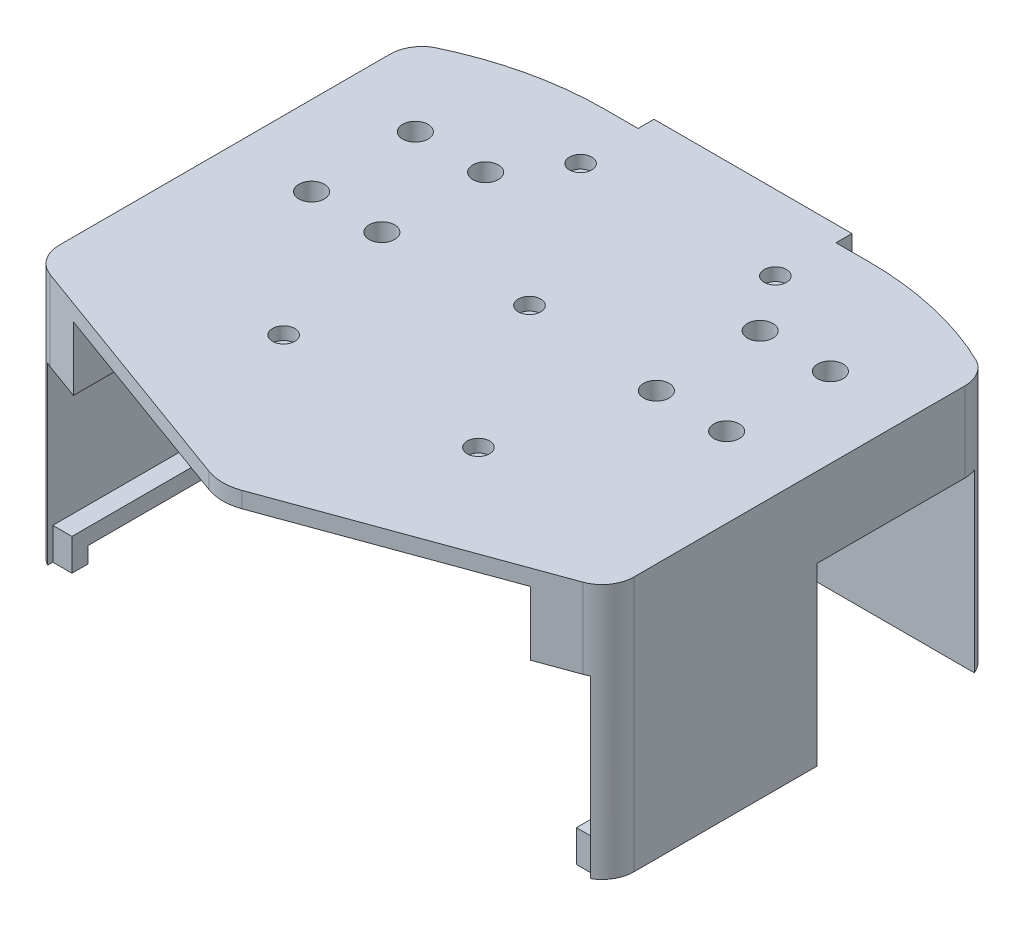
from build123d import *

# Parameters (mm, degrees)
BOSS_EXTRUDE1_DEPTH      = 40
BOSS_EXTRUDE1_DEPTH_BACK = 40
SKETCH1_W                = 180
SKETCH1_H                = 152.061
SHELL1_T                 = -5
SKETCH3_W                = 170
SKETCH3_H                = 142.061
BOSS_EXTRUDE2_DEPTH      = 20
SKETCH2_W                = 36
SKETCH2_H                = 55
CUT_EXTRUDE1_DEPTH       = 220
SKETCH4_W                = 36
SKETCH4_H                = 46.5
SKETCH4_R                = 1.5
CUT_EXTRUDE2_DEPTH       = 2
SKETCH4_3_R              = 1.5
CUT_EXTRUDE3_DEPTH       = 131.021678693
SKETCH5_W                = 159.952904784
SKETCH5_H                = 5
CUT_EXTRUDE4_DEPTH       = 63
SKETCH8_W                = 72
SKETCH8_H                = 29.937457508
CUT_EXTRUDE5_DEPTH       = 20
CUT_EXTRUDE7_DEPTH       = 102
SKETCH11_W               = 62
SKETCH11_H               = 5
BOSS_EXTRUDE3_DEPTH      = 80
SKETCH12_W               = 57
SKETCH12_H               = 3
SKETCH12_W_2             = 43
SKETCH12_H_2             = 2
CUT_EXTRUDE8_DEPTH       = 70
SKETCH13_W               = 57
SKETCH13_H               = 3
CUT_EXTRUDE9_DEPTH       = 7
SKETCH15_R               = 4
CUT_EXTRUDE10_DEPTH      = 17.5
SKETCH9_R                = 1.5
CUT_EXTRUDE11_DEPTH      = 10
BOSS_EXTRUDE4_DEPTH      = 10
SKETCH18_W               = 170
SKETCH18_H               = 5
SKETCH18_W_2             = 158
CUT_EXTRUDE12_DEPTH      = 114.303678916
FILLET3_R                = 100
FILLET2_R                = 10
FILLET1_R                = 15
SKETCH19_W               = 50
SKETCH19_H               = 65
CUT_EXTRUDE13_DEPTH      = 199
SKETCH20_W               = 6
SKETCH20_H               = 5
BOSS_EXTRUDE5_DEPTH      = 5
SKETCH24_R               = 3.5
CUT_EXTRUDE14_DEPTH      = 4


with BuildPart() as part:
    # Sketch1 → Boss-Extrude1 (new, two sides: drawn at the far end of the back side and taken through both)
    with BuildSketch(Plane(origin=(0, 0, 0), x_dir=(1, 0, 0), z_dir=(0, 1, 0)).offset(-BOSS_EXTRUDE1_DEPTH_BACK)):
        Rectangle(SKETCH1_W, SKETCH1_H)
    extrude(amount=BOSS_EXTRUDE1_DEPTH + BOSS_EXTRUDE1_DEPTH_BACK)

    # Shell1
    shell1_openings = [part.faces().sort_by_distance(p)[0] for p in [
        (0, -40, 0),
    ]]
    offset(amount=SHELL1_T, openings=shell1_openings, kind=Kind.INTERSECTION)

    # Sketch3 → Boss-Extrude2 (add)
    with BuildSketch(Plane.XZ.offset(-35)):
        Rectangle(SKETCH3_W, SKETCH3_H)
    extrude(amount=BOSS_EXTRUDE2_DEPTH)

    # Sketch2 → Cut-Extrude1 (cut)
    with BuildSketch(Plane.ZY.offset(90)):
        with Locations((-46.0305, -12.5)):
            Rectangle(SKETCH2_W, SKETCH2_H)
    extrude(amount=-CUT_EXTRUDE1_DEPTH, mode=Mode.SUBTRACT)

    # Sketch4 → Cut-Extrude2 (cut)
    with BuildSketch(Plane.XZ.offset(-15)):
        with Locations((-54, -34.0305)):
            Rectangle(SKETCH4_W, SKETCH4_H)
        with Locations(Location((-43, -50.2805, 0), (0, 0, 270))):
            Circle(SKETCH4_R, mode=Mode.SUBTRACT)
        with Locations(Location((-65, -50.2805, 0), (0, 0, 270))):
            Circle(SKETCH4_R, mode=Mode.SUBTRACT)
        with Locations(Location((-43, -17.7805, 0), (0, 0, 270))):
            Circle(SKETCH4_R, mode=Mode.SUBTRACT)
        with Locations(Location((-65, -17.7805, 0), (0, 0, 270))):
            Circle(SKETCH4_R, mode=Mode.SUBTRACT)
    cut_extrude2 = extrude(amount=-CUT_EXTRUDE2_DEPTH, mode=Mode.SUBTRACT)

    # Sketch4<3> → Cut-Extrude3 (cut, through all)
    with BuildSketch(Plane.XZ.offset(-15)):
        with BuildLine():
            Line((-65, -19.2805), (-65, -17.7805))
            Line((-65, -17.7805), (-63.5, -17.7805))
            ThreePointArc((-63.5, -17.7805), (-66.060660172, -16.719839828), (-65, -19.2805))
        make_face()
        with BuildLine():
            Line((-63.5, -17.7805), (-65, -17.7805))
            Line((-65, -17.7805), (-65, -19.2805))
            ThreePointArc((-65, -19.2805), (-63.939339828, -18.841160172), (-63.5, -17.7805))
        make_face()
        with BuildLine():
            Line((-65, -19.2805), (-65, -17.7805))
            Line((-65, -17.7805), (-63.5, -17.7805))
            ThreePointArc((-63.5, -17.7805), (-66.060660172, -16.719839828), (-65, -19.2805))
        make_face()
        with BuildLine():
            Line((-63.5, -17.7805), (-65, -17.7805))
            Line((-65, -17.7805), (-65, -19.2805))
            ThreePointArc((-65, -19.2805), (-63.939339828, -18.841160172), (-63.5, -17.7805))
        make_face()
        with Locations(Location((-43, -17.7805, 0), (0, 0, 270))):
            Circle(SKETCH4_3_R)
        with Locations(Location((-65, -50.2805, 0), (0, 0, 270))):
            Circle(SKETCH4_3_R)
        with Locations(Location((-43, -50.2805, 0), (0, 0, 270))):
            Circle(SKETCH4_3_R)
    cut_extrude3 = extrude(amount=-CUT_EXTRUDE3_DEPTH, mode=Mode.SUBTRACT)

    # Mirror2: Cut-Extrude2, Cut-Extrude3 across plane
    add(cut_extrude2.mirror(Plane(origin=(0, 0, 0), x_dir=(0, 0, 1), z_dir=(1, 0, 0))), mode=Mode.SUBTRACT)
    add(cut_extrude3.mirror(Plane(origin=(0, 0, 0), x_dir=(0, 0, 1), z_dir=(1, 0, 0))), mode=Mode.SUBTRACT)

    # Sketch5 → Cut-Extrude4 (cut)
    with BuildSketch(Plane.XZ.offset(-15)):
        with Locations((5.023547608, 73.5305)):
            Rectangle(SKETCH5_W, SKETCH5_H)
    extrude(amount=CUT_EXTRUDE4_DEPTH, mode=Mode.SUBTRACT)

    # Sketch8 → Cut-Extrude5 (cut)
    with BuildSketch(Plane.XZ.offset(-15)):
        Polygon((-36, -71.0305), (36, -71.0305), (36, -57.2805), (36, -10.7805), (-36, -10.7805), (-36, -57.2805), align=None)
        with Locations((0, 4.188228754)):
            Rectangle(SKETCH8_W, SKETCH8_H)
        Polygon((36, 19.156957508), (36, -10.7805), (71.419165144, -10.7805), (71.419165144, 76.0305), (-72, 76.0305), (-72, -10.7805), (-36, -10.7805), (-36, 19.156957508), align=None)
    extrude(amount=-CUT_EXTRUDE5_DEPTH, mode=Mode.SUBTRACT)

    # Sketch10 → Cut-Extrude7 (cut)
    with BuildSketch(Plane.XZ.offset(40)):
        Polygon((0, 76.0305), (90, 43.273178916), (90, 76.0305), align=None)
    cut_extrude7 = extrude(amount=-CUT_EXTRUDE7_DEPTH, mode=Mode.SUBTRACT)

    # Mirror3: Cut-Extrude7 across plane
    add(cut_extrude7.mirror(Plane(origin=(0, 0, 0), x_dir=(0, 0, 1), z_dir=(1, 0, 0))), mode=Mode.SUBTRACT)

    # Sketch11 → Boss-Extrude3 (add)
    with BuildSketch(Plane.XZ.offset(40)):
        Polygon((85, -86.0305), (85, -76.0305), (-85, -76.0305), (-85, -86.0305), (-31, -86.0305), (31, -86.0305), align=None)
        with Locations((0, -88.5305)):
            Rectangle(SKETCH11_W, SKETCH11_H)
    extrude(amount=-BOSS_EXTRUDE3_DEPTH)

    # Sketch12 → Cut-Extrude8 (cut)
    with BuildSketch(Plane.XZ.offset(40)):
        with Locations((0, -87.5305)):
            Rectangle(SKETCH12_W, SKETCH12_H)
        with Locations((0, -90.0305)):
            Rectangle(SKETCH12_W_2, SKETCH12_H_2)
    extrude(amount=-CUT_EXTRUDE8_DEPTH, mode=Mode.SUBTRACT)

    # Sketch13 → Cut-Extrude9 (cut)
    with BuildSketch(Plane.XZ.offset(-30)):
        with Locations((0, -87.5305)):
            Rectangle(SKETCH13_W, SKETCH13_H)
    extrude(amount=-CUT_EXTRUDE9_DEPTH, mode=Mode.SUBTRACT)

    # Sketch15 → Cut-Extrude10 (cut)
    with BuildSketch(Plane(origin=(0, 40, 0), x_dir=(1, 0, 0), z_dir=(0, 1, 0))):
        with Locations(Location((65, 17.7805, 0), (0, 0, 270))):
            Circle(SKETCH15_R)
        with Locations(Location((43, 17.7805, 0), (0, 0, 270))):
            Circle(SKETCH15_R)
        with Locations(Location((65, 50.2805, 0), (0, 0, 270))):
            Circle(SKETCH15_R)
        with Locations(Location((-43, 50.2805, 0), (0, 0, 90))):
            Circle(SKETCH15_R)
        with Locations(Location((43, 50.2805, 0), (0, 0, 270))):
            Circle(SKETCH15_R)
        with Locations(Location((-65, 50.2805, 0), (0, 0, 90))):
            Circle(SKETCH15_R)
        with Locations(Location((-43, 17.7805, 0), (0, 0, 90))):
            Circle(SKETCH15_R)
        with Locations(Location((-65, 17.7805, 0), (0, 0, 90))):
            Circle(SKETCH15_R)
    extrude(amount=-CUT_EXTRUDE10_DEPTH, mode=Mode.SUBTRACT)

    # Sketch9 → Cut-Extrude11 (cut)
    with BuildSketch(Plane.XZ.offset(-35)):
        with Locations(Location((30.5, -67.5305, 0), (0, 0, 270))):
            Circle(SKETCH9_R)
        with Locations(Location((-30.5, -67.5305, 0), (0, 0, 270))):
            Circle(SKETCH9_R)
        with Locations(Location((30.5, 25.4695, 0), (0, 0, 270))):
            Circle(SKETCH9_R)
        with Locations(Location((-30.5, 25.4695, 0), (0, 0, 270))):
            Circle(SKETCH9_R)
        with Locations(Location((0, -21.0305, 0), (0, 0, 270))):
            Circle(SKETCH9_R)
    extrude(amount=-CUT_EXTRUDE11_DEPTH, mode=Mode.SUBTRACT)

    # Sketch17 → Boss-Extrude4 (add)
    with BuildSketch(Plane.XZ.offset(30)):
        Polygon((90, 43.273178916), (-90, 43.273178916), (-90, -76.0305), (-85, -76.0305), (85, -76.0305), (90, -76.0305), align=None)
    extrude(amount=BOSS_EXTRUDE4_DEPTH)

    # Sketch18 → Cut-Extrude12 (cut)
    with BuildSketch(Plane.XY.offset(43.273178916)):
        with Locations((0, -37.5)):
            Rectangle(SKETCH18_W, SKETCH18_H)
        with Locations((0, -32.5)):
            Rectangle(SKETCH18_W_2, SKETCH18_H)
    extrude(amount=-CUT_EXTRUDE12_DEPTH, mode=Mode.SUBTRACT)

    # Fillet3
    # the kernel refuses this fillet: 100 mm, written as the material it takes off along each edge
    with BuildSketch(Plane(origin=(-85, -148.972473589, -86.0305), x_dir=(0, 0, 1), z_dir=(0, 1, 0))) as fillet3_piece_1:
        with BuildLine():
            CenterArc((100, 43.588989435), FILLET3_R, 180, 25.841932763)
            Line((0, 43.588989435), (0, 0))
            Line((0, 0), (10, 0))
        make_face()
    extrude(amount=297.944947177, mode=Mode.SUBTRACT)
    with BuildSketch(Plane(origin=(85, -148.972473589, -86.0305), x_dir=(-1, 0, 0), z_dir=(0, 1, 0))) as fillet3_piece_2:
        with BuildLine():
            CenterArc((43.588989435, 100), FILLET3_R, 244.158067237, 25.841932763)
            Line((0, 10), (0, 0))
            Line((0, 0), (43.588989435, 0))
        make_face()
    extrude(amount=297.944947177, mode=Mode.SUBTRACT)

    # Fillet2
    # the kernel refuses this fillet: 10 mm, written as the material it takes off along each edge
    with BuildSketch(Plane(origin=(90, -61.650635095, -76.0305), x_dir=(0, 0, 1), z_dir=(0, 1, 0)), Plane(origin=(-90, 61.650635095, -76.0305), x_dir=(0, 0, 1), z_dir=(0, -1, 0))) as fillet2_piece_1:
        with BuildLine():
            CenterArc((8.660254038, -10), FILLET2_R, 90, 60)
            Line((0, -5), (0, 0))
            Line((0, 0), (8.660254038, 0))
        make_face()
    extrude(amount=123.301270189, mode=Mode.SUBTRACT)
    with BuildSketch(Plane(origin=(-90, 57.505188455, 43.273178916), x_dir=(0.9396926207859103, 0, 0.34202014332566333), z_dir=(0, -1, 0)), Plane(origin=(90, -57.505188455, 43.273178916), x_dir=(-0.9396926207859106, 0, 0.34202014332566244), z_dir=(0, 1, 0))) as fillet2_piece_2:
        with BuildLine():
            CenterArc((FILLET2_R * 0.70020753821, -FILLET2_R), FILLET2_R, 90, 70)
            Line((-FILLET2_R * 0.239485082576, -FILLET2_R * 0.657979856674), (0, 0))
            Line((0, 0), (FILLET2_R * 0.70020753821, 0))
        make_face()
    extrude(amount=115.01037691, mode=Mode.SUBTRACT)

    # Fillet1
    fillet1_edges = [part.edges().sort_by_distance(p)[0] for p in [
        (0, 37.5, 76.0305),
    ]]
    fillet(fillet1_edges, radius=FILLET1_R)

    # Sketch19 → Cut-Extrude13 (cut)
    with BuildSketch(Plane(origin=(90, 0, 0), x_dir=(0, 0, -1), z_dir=(1, 0, 0))):
        with Locations((46.0305, -17.5)):
            Rectangle(SKETCH19_W, SKETCH19_H)
    extrude(amount=-CUT_EXTRUDE13_DEPTH, mode=Mode.SUBTRACT)

    # Sketch20 → Boss-Extrude5 (add)
    with BuildSketch(Plane.XZ.offset(35)):
        with Locations((-82, 40.773178916)):
            Rectangle(SKETCH20_W, SKETCH20_H)
        with Locations((82, 40.773178916)):
            Rectangle(SKETCH20_W, SKETCH20_H)
    extrude(amount=BOSS_EXTRUDE5_DEPTH)

    # Sketch24 → Cut-Extrude14 (cut)
    with BuildSketch(Plane(origin=(0, 40, 0), x_dir=(1, 0, 0), z_dir=(0, 1, 0))):
        with Locations(Location((0, 21.0305, 0), (0, 0, 270))):
            Circle(SKETCH24_R)
        with Locations(Location((-30.5, 67.5305, 0), (0, 0, 270))):
            Circle(SKETCH24_R)
        with Locations(Location((30.5, 67.5305, 0), (0, 0, 270))):
            Circle(SKETCH24_R)
        with Locations(Location((-30.5, -25.4695, 0), (0, 0, 270))):
            Circle(SKETCH24_R)
        with Locations(Location((30.5, -25.4695, 0), (0, 0, 270))):
            Circle(SKETCH24_R)
    extrude(amount=-CUT_EXTRUDE14_DEPTH, mode=Mode.SUBTRACT)


solid = part.part
